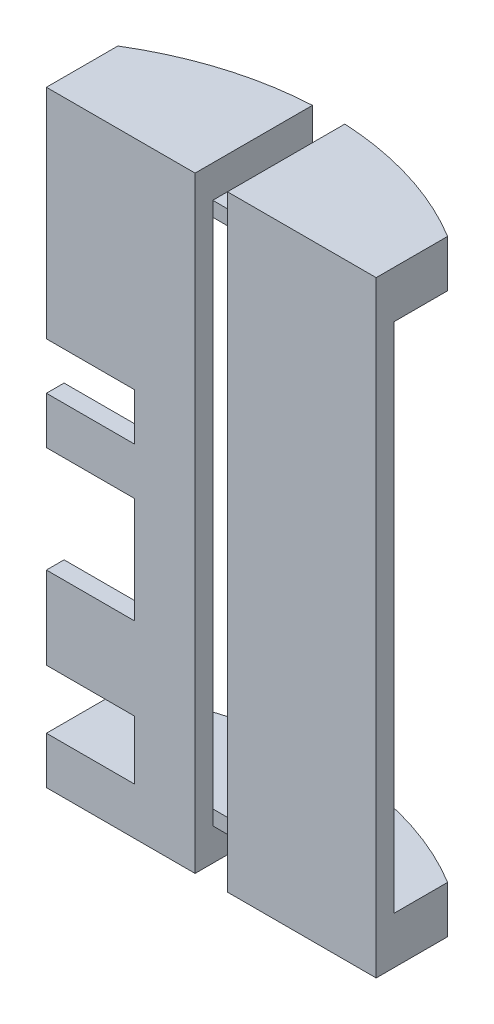
from build123d import *

# Parameters (mm, degrees)
SKETCH2_R                = 53.75
BOSS_EXTRUDE1_DEPTH      = 103
CUT_EXTRUDE2_DEPTH       = 129.012206449
CUT_EXTRUDE2_DEPTH_BACK  = 129.012206449
SKETCH3_W                = 107.5
SKETCH3_H                = 87.5
SKETCH6_W                = 83.666002654
SKETCH6_H                = 87
CUT_EXTRUDE6_DEPTH       = 17
CUT_EXTRUDE7_DEPTH       = 124.483045395
CUT_EXTRUDE7_DEPTH_BACK  = 124.483045395
SKETCH7_W                = 5.5
SKETCH7_H                = 3
CUT_EXTRUDE8_DEPTH       = 113.955743546
CUT_EXTRUDE8_DEPTH_BACK  = 113.955743546
SKETCH8_W                = 5.5
SKETCH8_H                = 5.5
CUT_EXTRUDE11_DEPTH      = 113.955743546
CUT_EXTRUDE11_DEPTH_BACK = 42
SKETCH10_W               = 13.833001327
SKETCH10_H               = 103
CUT_EXTRUDE12_DEPTH      = 109.083301208
CUT_EXTRUDE12_DEPTH_BACK = 109.083301208
SKETCH11_W               = 15
SKETCH11_H               = 10
SKETCH11_H_2             = 18
SKETCH11_H_3             = 8


with BuildPart() as part:
    # Sketch2 → Boss-Extrude1 (new body)
    with BuildSketch(Plane(origin=(0, 0, 0), x_dir=(1, 0, 0), z_dir=(0, 1, 0))):
        Circle(SKETCH2_R)
    extrude(amount=BOSS_EXTRUDE1_DEPTH)

    # Sketch3 → Cut-Extrude2 (cut, two sides: drawn at the far end of the back side and taken through both)
    with BuildSketch(Plane(origin=(0, 103, 0), x_dir=(1, 0, 0), z_dir=(0, 1, 0)).offset(-CUT_EXTRUDE2_DEPTH_BACK)):
        with Locations((0, -10)):
            Rectangle(SKETCH3_W, SKETCH3_H)
    extrude(amount=CUT_EXTRUDE2_DEPTH + CUT_EXTRUDE2_DEPTH_BACK, mode=Mode.SUBTRACT)

    # Sketch6 → Cut-Extrude6 (cut)
    with BuildSketch(Plane.XY.offset(-53.75)):
        with Locations((0, 51.5)):
            Rectangle(SKETCH6_W, SKETCH6_H)
    extrude(amount=CUT_EXTRUDE6_DEPTH, mode=Mode.SUBTRACT)

    # Sketch7 → Cut-Extrude7 (cut, two sides: drawn at the far end of the back side and taken through both)
    with BuildSketch(Plane.XZ.offset(-CUT_EXTRUDE7_DEPTH_BACK)):
        with Locations((0, -35.25)):
            Rectangle(SKETCH7_W, SKETCH7_H)
    extrude(amount=CUT_EXTRUDE7_DEPTH + CUT_EXTRUDE7_DEPTH_BACK, mode=Mode.SUBTRACT)

    # Sketch8 → Cut-Extrude8 (cut, two sides: drawn at the far end of the back side and taken through both)
    with BuildSketch(Plane.XY.offset(-33.75).offset(-CUT_EXTRUDE8_DEPTH_BACK)):
        with Locations((0, 100.25)):
            Rectangle(SKETCH8_W, SKETCH8_H)
        with Locations((0, 2.75)):
            Rectangle(SKETCH8_W, SKETCH8_H)
    extrude(amount=CUT_EXTRUDE8_DEPTH + CUT_EXTRUDE8_DEPTH_BACK, mode=Mode.SUBTRACT)

    # Sketch10 → Cut-Extrude11 (cut, two sides: drawn at the far end of the back side and taken through both)
    with BuildSketch(Plane.XY.offset(-53.75).offset(-CUT_EXTRUDE11_DEPTH_BACK)):
        with Locations((34.916500664, 51.5)):
            Rectangle(SKETCH10_W, SKETCH10_H)
        with Locations((-34.916500664, 51.5)):
            Rectangle(SKETCH10_W, SKETCH10_H)
    extrude(amount=CUT_EXTRUDE11_DEPTH + CUT_EXTRUDE11_DEPTH_BACK, mode=Mode.SUBTRACT)

    # Sketch11 → Cut-Extrude12 (cut, two sides: drawn at the far end of the back side and taken through both)
    with BuildSketch(Plane(origin=(0, 0, -36.75), x_dir=(-1, 0, 0), z_dir=(0, 0, -1)).offset(-CUT_EXTRUDE12_DEPTH_BACK)):
        with Locations((20.5, 13)):
            Rectangle(SKETCH11_W, SKETCH11_H)
        with Locations((20.5, 41)):
            Rectangle(SKETCH11_W, SKETCH11_H_2)
        with Locations((20.5, 62)):
            Rectangle(SKETCH11_W, SKETCH11_H_3)
    extrude(amount=CUT_EXTRUDE12_DEPTH + CUT_EXTRUDE12_DEPTH_BACK, mode=Mode.SUBTRACT)


solid = part.part
